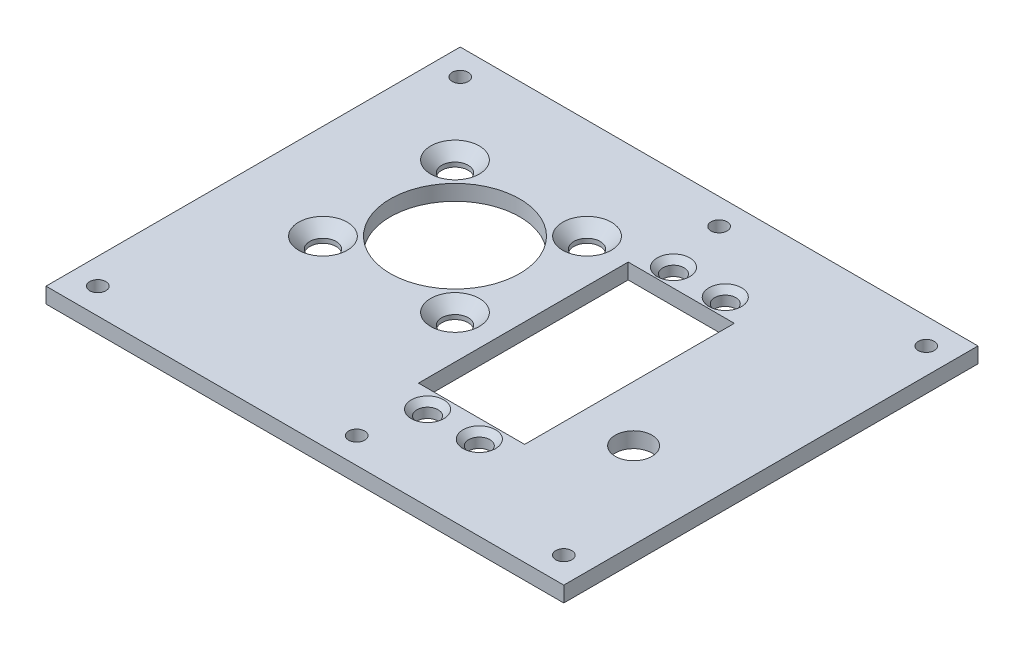
from build123d import *

# Parameters (mm, degrees)
SZKIC1_W                                     = 100
SZKIC1_H                                     = 80
SZKIC1_R                                     = 1.55
SZKIC1_R_2                                   = 2.55
SZKIC1_R_3                                   = 2.05
SZKIC1_R_4                                   = 3.55
SZKIC1_R_5                                   = 12.5
SZKIC1_W_2                                   = 20.5
SZKIC1_H_2                                   = 40.5
DODANIE_WYCI_GNI_CIE1_DEPTH                  = 3
CSK_FOR_M4_COUNTERSUNK_FLAT_HEAD_SCR_2_COUNT = 2
CSK_FOR_M4_COUNTERSUNK_FLAT_HEAD_SCR_2_PITCH = 25.5
CSK_FOR_M4_COUNTERSUNK_FLAT_HEAD_SCR_3_COUNT = 2
CSK_FOR_M4_COUNTERSUNK_FLAT_HEAD_SCR_3_PITCH = 36.062445841
CSK_FOR_M4_COUNTERSUNK_FLAT_HEAD_SCR_4_COUNT = 2
CSK_FOR_M4_COUNTERSUNK_FLAT_HEAD_SCR_4_PITCH = 25.5
CSK_FOR_M3_COUNTERSUNK_FLAT_HEAD_SCR_2_COUNT = 2
CSK_FOR_M3_COUNTERSUNK_FLAT_HEAD_SCR_2_PITCH = 10
CSK_FOR_M3_COUNTERSUNK_FLAT_HEAD_SCR_3_COUNT = 2
CSK_FOR_M3_COUNTERSUNK_FLAT_HEAD_SCR_3_PITCH = 47.5
CSK_FOR_M3_COUNTERSUNK_FLAT_HEAD_SCR_4_COUNT = 2
CSK_FOR_M3_COUNTERSUNK_FLAT_HEAD_SCR_4_PITCH = 48.541219597


with BuildPart() as part:
    # Szkic1 → Dodanie-wyciągnięcie1 (new body)
    with BuildSketch(Plane(origin=(0, 0, 0), x_dir=(1, 0, 0), z_dir=(0, 1, 0))):
        with Locations((11.336719097, -8.838965942)):
            Rectangle(SZKIC1_W, SZKIC1_H)
        with Locations((-33.663280903, -43.838965942)):
            Circle(SZKIC1_R, mode=Mode.SUBTRACT)
        with Locations((-20.268770099, -13.743104788)):
            Circle(SZKIC1_R_2, mode=Mode.SUBTRACT)
        with Locations((5.231229901, -13.743104788)):
            Circle(SZKIC1_R_2, mode=Mode.SUBTRACT)
        with Locations((16.336719097, -43.838965942)):
            Circle(SZKIC1_R, mode=Mode.SUBTRACT)
        with Locations((18.775116298, -32.588965942)):
            Circle(SZKIC1_R_3, mode=Mode.SUBTRACT)
        with Locations((28.775116298, -32.588965942)):
            Circle(SZKIC1_R_3, mode=Mode.SUBTRACT)
        with Locations((56.336719097, -43.838965942)):
            Circle(SZKIC1_R, mode=Mode.SUBTRACT)
        with Locations((44.775116298, -18.788965942)):
            Circle(SZKIC1_R_4, mode=Mode.SUBTRACT)
        with Locations((-7.518770099, -0.993104788)):
            Circle(SZKIC1_R_5, mode=Mode.SUBTRACT)
        with Locations((-20.268770099, 11.756895212)):
            Circle(SZKIC1_R_2, mode=Mode.SUBTRACT)
        with Locations((-33.663280903, 26.161034058)):
            Circle(SZKIC1_R, mode=Mode.SUBTRACT)
        with Locations((5.231229901, 11.756895212)):
            Circle(SZKIC1_R_2, mode=Mode.SUBTRACT)
        with Locations((23.775116298, -8.838965942)):
            Rectangle(SZKIC1_W_2, SZKIC1_H_2, mode=Mode.SUBTRACT)
        with Locations((18.775116298, 14.911034058)):
            Circle(SZKIC1_R_3, mode=Mode.SUBTRACT)
        with Locations((28.775116298, 14.911034058)):
            Circle(SZKIC1_R_3, mode=Mode.SUBTRACT)
        with Locations((16.336719097, 26.161034058)):
            Circle(SZKIC1_R, mode=Mode.SUBTRACT)
        with Locations((56.336719097, 26.161034058)):
            Circle(SZKIC1_R, mode=Mode.SUBTRACT)
    extrude(amount=DODANIE_WYCI_GNI_CIE1_DEPTH)

    # Sketch4 → CSK for M4 Countersunk Flat Head Screw1 (revolve, cut)
    with BuildSketch(Plane(origin=(-20.268770099, 3, 13.743104788), x_dir=(0, 0, 1), z_dir=(1, 0, 0))):
        Polygon((0, 0), (0, 3), (2.25, 3), (2.25, 2.45), (4.7, 0), align=None)
    csk_for_m4_countersunk_flat_head_screw1 = revolve(axis=Axis((-20.268770099, 9.35, 13.743104788), (0, -1, 0)), mode=Mode.SUBTRACT)

    # CSK for M4 Countersunk Flat Head Scr 2: CSK for M4 Countersunk Flat Head Screw1 ×2
    with Locations(*[(i * CSK_FOR_M4_COUNTERSUNK_FLAT_HEAD_SCR_2_PITCH, 0, 0) for i in range(1, CSK_FOR_M4_COUNTERSUNK_FLAT_HEAD_SCR_2_COUNT)]):
        add(csk_for_m4_countersunk_flat_head_screw1, mode=Mode.SUBTRACT)

    # CSK for M4 Countersunk Flat Head Scr 3: CSK for M4 Countersunk Flat Head Screw1 ×2
    with Locations(*[Vector(0.7071067811865475, 0, -0.7071067811865476) * (i * CSK_FOR_M4_COUNTERSUNK_FLAT_HEAD_SCR_3_PITCH) for i in range(1, CSK_FOR_M4_COUNTERSUNK_FLAT_HEAD_SCR_3_COUNT)]):
        add(csk_for_m4_countersunk_flat_head_screw1, mode=Mode.SUBTRACT)

    # CSK for M4 Countersunk Flat Head Scr 4: CSK for M4 Countersunk Flat Head Screw1 ×2
    with Locations(*[(0, 0, -i * CSK_FOR_M4_COUNTERSUNK_FLAT_HEAD_SCR_4_PITCH) for i in range(1, CSK_FOR_M4_COUNTERSUNK_FLAT_HEAD_SCR_4_COUNT)]):
        add(csk_for_m4_countersunk_flat_head_screw1, mode=Mode.SUBTRACT)

    # Sketch6 → CSK for M3 Countersunk Flat Head Screw1 (revolve, cut)
    with BuildSketch(Plane(origin=(18.775116298, 3, -14.911034058), x_dir=(0, 0, 1), z_dir=(1, 0, 0))):
        Polygon((0, 0), (0, 3), (1.7, 3), (1.7, 1.45), (3.15, 0), align=None)
    csk_for_m3_countersunk_flat_head_screw1 = revolve(axis=Axis((18.775116298, 9.35, -14.911034058), (0, -1, 0)), mode=Mode.SUBTRACT)

    # CSK for M3 Countersunk Flat Head Scr 2: CSK for M3 Countersunk Flat Head Screw1 ×2
    with Locations(*[(i * CSK_FOR_M3_COUNTERSUNK_FLAT_HEAD_SCR_2_PITCH, 0, 0) for i in range(1, CSK_FOR_M3_COUNTERSUNK_FLAT_HEAD_SCR_2_COUNT)]):
        add(csk_for_m3_countersunk_flat_head_screw1, mode=Mode.SUBTRACT)

    # CSK for M3 Countersunk Flat Head Scr 3: CSK for M3 Countersunk Flat Head Screw1 ×2
    with Locations(*[(0, 0, i * CSK_FOR_M3_COUNTERSUNK_FLAT_HEAD_SCR_3_PITCH) for i in range(1, CSK_FOR_M3_COUNTERSUNK_FLAT_HEAD_SCR_3_COUNT)]):
        add(csk_for_m3_countersunk_flat_head_screw1, mode=Mode.SUBTRACT)

    # CSK for M3 Countersunk Flat Head Scr 4: CSK for M3 Countersunk Flat Head Screw1 ×2
    with Locations(*[Vector(0.20601048104984204, 0, 0.9785497849867489) * (i * CSK_FOR_M3_COUNTERSUNK_FLAT_HEAD_SCR_4_PITCH) for i in range(1, CSK_FOR_M3_COUNTERSUNK_FLAT_HEAD_SCR_4_COUNT)]):
        add(csk_for_m3_countersunk_flat_head_screw1, mode=Mode.SUBTRACT)


solid = part.part
